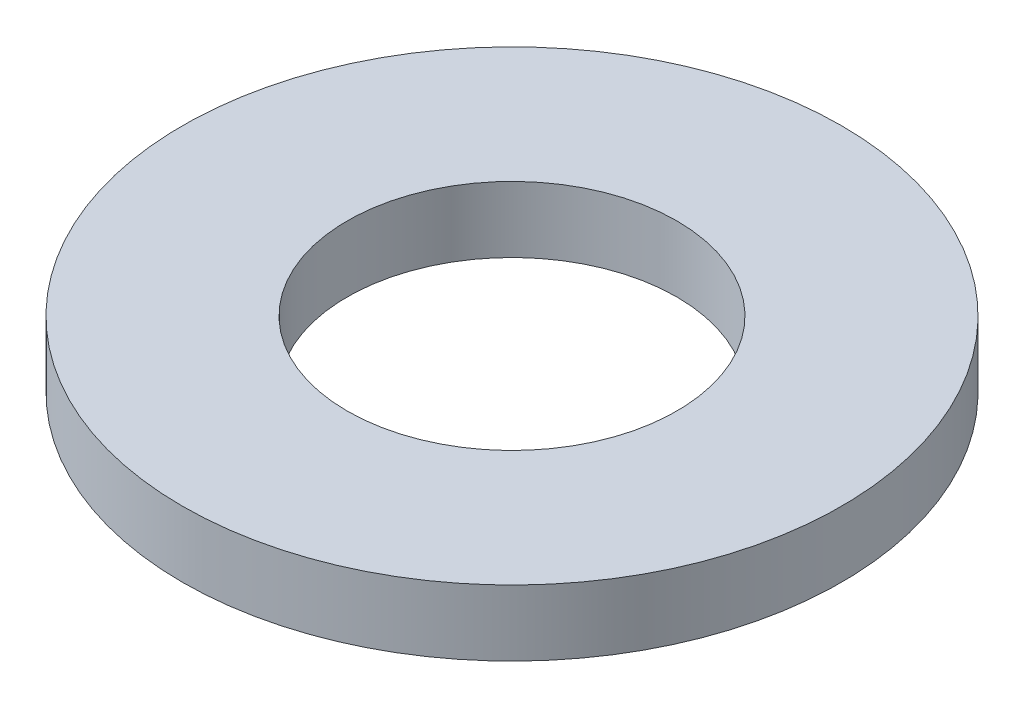
from build123d import *

# Parameters (mm, degrees)
SKETCH1_R           = 60
BOSS_EXTRUDE1_DEPTH = 12
SKETCH2_R           = 30
CUT_EXTRUDE1_DEPTH  = 86.697141143


with BuildPart() as part:
    # Sketch1 → Boss-Extrude1 (new body)
    with BuildSketch(Plane(origin=(0, 0, 0), x_dir=(1, 0, 0), z_dir=(0, 1, 0))):
        Circle(SKETCH1_R)
    extrude(amount=BOSS_EXTRUDE1_DEPTH)

    # Sketch2 → Cut-Extrude1 (cut, through all)
    with BuildSketch(Plane(origin=(0, 0, 0), x_dir=(1, 0, 0), z_dir=(0, 1, 0))):
        Circle(SKETCH2_R)
    extrude(amount=CUT_EXTRUDE1_DEPTH, mode=Mode.SUBTRACT)


solid = part.part
